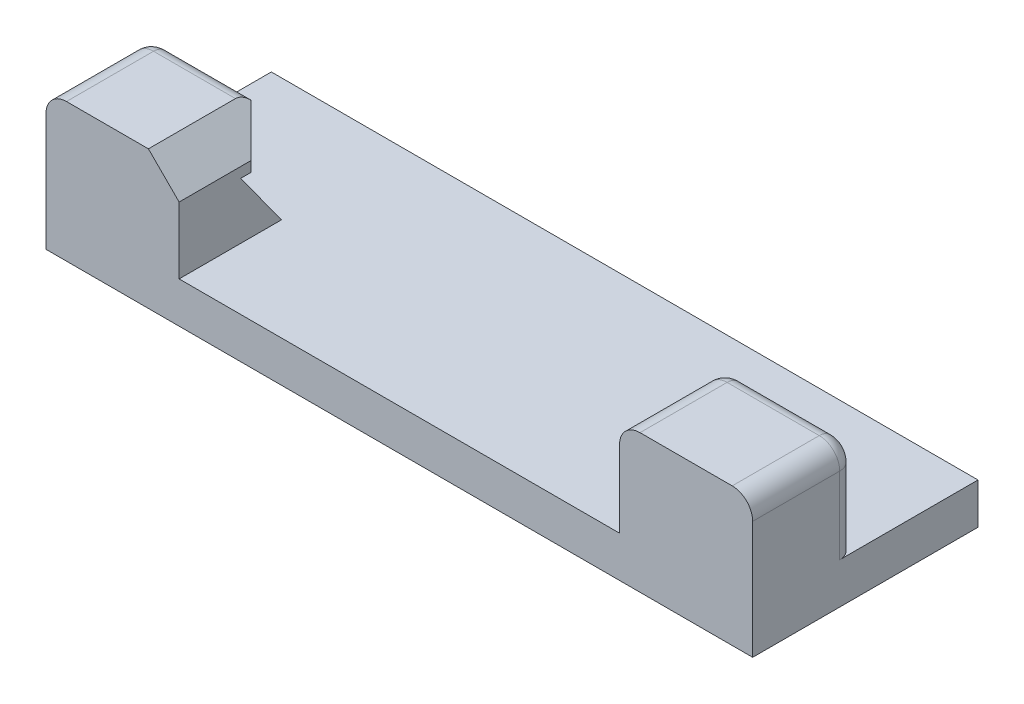
from build123d import *

# Parameters (mm, degrees)
BOSS_EXTRUDE1_DEPTH      = 3
BOSS_EXTRUDE1_DEPTH_BACK = 1
SKETCH1_W                = 69
SKETCH1_H                = 22
SKETCH2_W                = 13
SKETCH2_H                = 10
BOSS_EXTRUDE2_DEPTH      = 9.5
CUT_EXTRUDE1_DEPTH       = 10
FILLET1_R                = 2
FILLET2_R                = 1.5
CHAMFER1_SIZE            = 3
FILLET3_R                = 1.5
FILLET4_R                = 2


with BuildPart() as part:
    # Sketch1 → Boss-Extrude1 (new, two sides: drawn at the far end of the back side and taken through both)
    with BuildSketch(Plane(origin=(0, 0, 0), x_dir=(1, 0, 0), z_dir=(0, 1, 0)).offset(-BOSS_EXTRUDE1_DEPTH_BACK)):
        Rectangle(SKETCH1_W, SKETCH1_H)
    extrude(amount=BOSS_EXTRUDE1_DEPTH + BOSS_EXTRUDE1_DEPTH_BACK)

    # Sketch2 → Boss-Extrude2 (add)
    with BuildSketch(Plane(origin=(0, 3, 0), x_dir=(1, 0, 0), z_dir=(0, 1, 0))):
        with Locations((-28, -6)):
            Rectangle(SKETCH2_W, SKETCH2_H)
        with Locations((28, -6)):
            Rectangle(SKETCH2_W, SKETCH2_H)
    extrude(amount=BOSS_EXTRUDE2_DEPTH)

    # Sketch3 → Cut-Extrude1 (cut)
    with BuildSketch(Plane(origin=(-21.5, 0, 0), x_dir=(0, 0, -1), z_dir=(1, 0, 0))):
        Polygon((-1, 3), (-1, 8.5), (-5, 8.5), align=None)
    extrude(amount=-CUT_EXTRUDE1_DEPTH, mode=Mode.SUBTRACT)

    # Fillet1
    fillet1_edges = [part.edges().sort_by_distance(p)[0] for p in [
        (34.5, 12.5, 6),
        (21.5, 12.5, 6),
    ]]
    fillet(fillet1_edges, radius=FILLET1_R)

    # Fillet2
    fillet2_edges = [part.edges().sort_by_distance(p)[0] for p in [
        (28, 12.5, 1),
        (21.5, 6.75, 1),
        (34.5, 6.75, 1),
        (33.914213562, 11.914213562, 1),
        (22.085786438, 11.914213562, 1),
    ]]
    fillet(fillet2_edges, radius=FILLET2_R)

    # Chamfer1
    chamfer1_edges = [part.edges().sort_by_distance(p)[0] for p in [
        (-21.5, 10.5, 1),
        (-21.5, 12.5, 6),
    ]]
    chamfer(chamfer1_edges, length=CHAMFER1_SIZE)

    # Fillet3
    fillet3_edges = [part.edges().sort_by_distance(p)[0] for p in [
        (-34.5, 7.75, 1),
        (-29.5, 12.5, 1),
    ]]
    fillet(fillet3_edges, radius=FILLET3_R)

    # Fillet4
    # the kernel refuses this fillet: 2 mm, written as the material it takes off along each edge
    with BuildSketch(Plane(origin=(-32.5, 10.5, 1), x_dir=(-1, 0, 0), z_dir=(0, -1, 0))) as fillet4_piece_1:
        with BuildLine():
            CenterArc((0.5, -1.5), 1.5, 0, 90)
            Line((2, -1.5), (2, 0))
            Line((2, 0), (0.5, 0))
        make_face()
    revolve(axis=Axis((-32.5, 10.5, 1), (0, 0, -1)), revolution_arc=90, mode=Mode.SUBTRACT)
    with BuildSketch(Plane(origin=(-34.5, 12.5, 1), x_dir=(0, -1, 0), z_dir=(0, 0, 1))) as fillet4_piece_2:
        with BuildLine():
            CenterArc((FILLET4_R, FILLET4_R), FILLET4_R, 180, 90)
            Line((0, FILLET4_R), (0, 0))
            Line((0, 0), (FILLET4_R, 0))
        make_face()
    extrude(amount=15, mode=Mode.SUBTRACT)


solid = part.part
